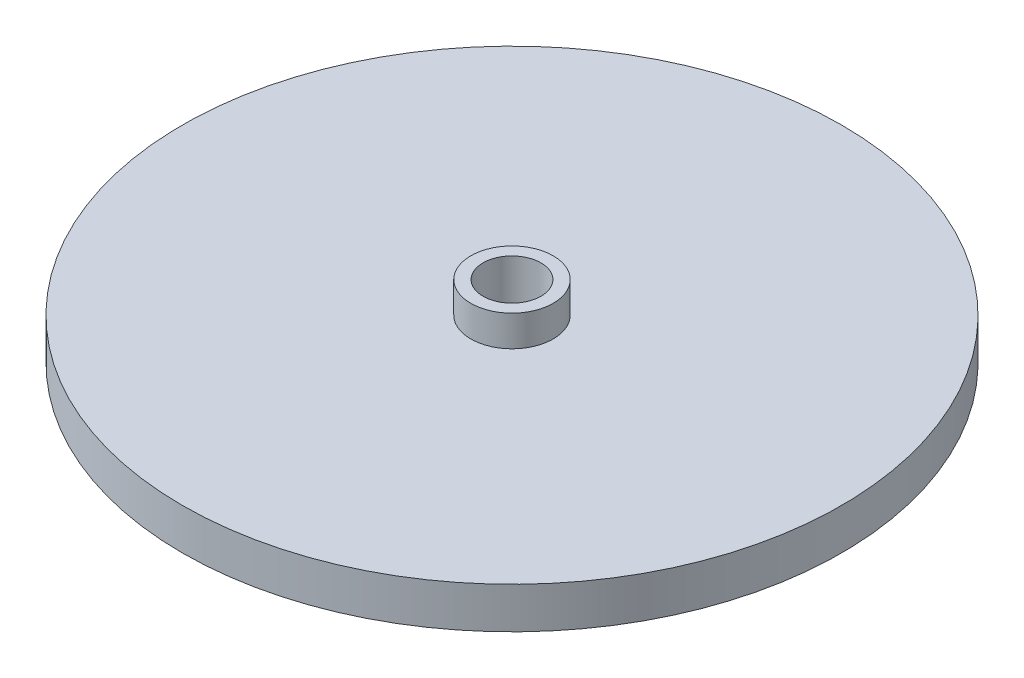
from build123d import *

# Parameters (mm, degrees)
SKETCH2_R                         = 12.7
BOSS_EXTRUDE1_DEPTH               = 9.525
PIPE_TAP_DRILL_FOR_1_2_TAP1_D     = 17.8562
PIPE_TAP_DRILL_FOR_1_2_TAP1_DEPTH = 31.75
PIPE_TAP_DRILL_FOR_1_2_TAP1_TIP   = 5.364543693


with BuildPart() as part:
    # Sketch1 → Revolve1 (revolve)
    with BuildSketch(Plane.XY):
        Polygon((-101.6, 0), (-101.6, -12.7), (-48.821281066, -12.7), (-48.821281066, -10.922), (-46.281281066, -10.922), (-46.281281066, -12.7), (-44.45, -12.7), (-44.45, -6.35), (0, -6.35), (0, 0), align=None)
    revolve(axis=Axis((0, -6.35, 0), (0, 1, 0)))

    # Sketch2 → Boss-Extrude1 (add)
    with BuildSketch(Plane(origin=(0, 0, 0), x_dir=(1, 0, 0), z_dir=(0, 1, 0))):
        Circle(SKETCH2_R)
    extrude(amount=BOSS_EXTRUDE1_DEPTH)

    # Pipe Tap Drill for 1/2 Tap1
    with Locations(Plane(origin=(0, 9.525, 0), x_dir=(1, 0, 0), z_dir=(0, 1, 0))):
        with Locations((0, 0)):
            Hole(PIPE_TAP_DRILL_FOR_1_2_TAP1_D / 2, depth=PIPE_TAP_DRILL_FOR_1_2_TAP1_DEPTH)
            with Locations((0, 0, -(PIPE_TAP_DRILL_FOR_1_2_TAP1_DEPTH + PIPE_TAP_DRILL_FOR_1_2_TAP1_TIP / 2))):  # 118° drill point
                Cone(0, PIPE_TAP_DRILL_FOR_1_2_TAP1_D / 2, PIPE_TAP_DRILL_FOR_1_2_TAP1_TIP, mode=Mode.SUBTRACT)


solid = part.part
